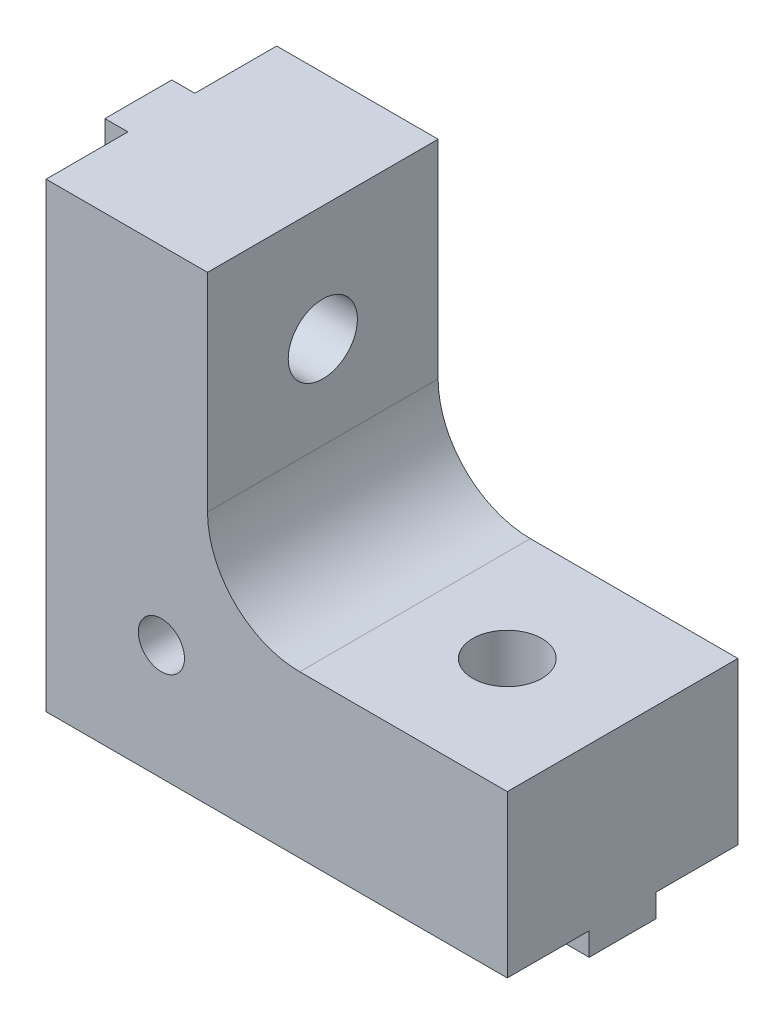
from build123d import *

# Parameters (mm, degrees)
MAIN_DEPTH                         = 10
ESQUISSE4_W                        = 2.9
ESQUISSE4_H                        = 20
MAKERBEAMFIXVERTICAL_DEPTH         = 1
MAKERBEAMVERTICALHOLE_DEPTH        = 31
MAKERBEAMVERTICALHOLE_DEPTH_BACK   = 31
ESQUISSE2_R                        = 1.5
ESQUISSE5_W                        = 20
ESQUISSE5_H                        = 2.9
MAKERBEAMFIXHORIZONTAL_DEPTH       = 1
MAKERBEAMHORIZONTALHOLE_DEPTH      = 31
MAKERBEAMHORIZONTALHOLE_DEPTH_BACK = 31
ESQUISSE3_R                        = 1.5
SKETCH1_R                          = 1
CUT_EXTRUDE1_DEPTH                 = 31


with BuildPart() as part:
    # Esquisse1 → Main (new body)
    with BuildSketch(Plane.XY):
        with BuildLine():
            Line((0, 0), (20, 0))
            Line((20, 0), (20, 7))
            Line((20, 7), (11, 7))
            ThreePointArc((11, 7), (8.171572875, 8.171572875), (7, 11))
            Line((7, 11), (7, 20))
            Line((7, 20), (0, 20))
            Line((0, 20), (0, 0))
        make_face()
    extrude(amount=MAIN_DEPTH)

    # Esquisse4 → MakerBeamFixVertical (add)
    with BuildSketch(Plane.ZY):
        with Locations((5, 10)):
            Rectangle(ESQUISSE4_W, ESQUISSE4_H)
    extrude(amount=MAKERBEAMFIXVERTICAL_DEPTH)

    # Esquisse2 → MakerBeamVerticalHole (cut, two sides: drawn at the far end of the back side and taken through both)
    with BuildSketch(Plane.ZY.offset(-MAKERBEAMVERTICALHOLE_DEPTH_BACK)):
        with Locations((5, 15)):
            Circle(ESQUISSE2_R)
    extrude(amount=MAKERBEAMVERTICALHOLE_DEPTH + MAKERBEAMVERTICALHOLE_DEPTH_BACK, mode=Mode.SUBTRACT)

    # Esquisse5 → MakerBeamFixHorizontal (add)
    with BuildSketch(Plane(origin=(0, 0, 0), x_dir=(-1, 0, 0), z_dir=(0, -1, 0))):
        with Locations((-10, -5)):
            Rectangle(ESQUISSE5_W, ESQUISSE5_H)
    extrude(amount=MAKERBEAMFIXHORIZONTAL_DEPTH)

    # Esquisse3 → MakerBeamHorizontalHole (cut, two sides: drawn at the far end of the back side and taken through both)
    with BuildSketch(Plane.XZ.offset(-MAKERBEAMHORIZONTALHOLE_DEPTH_BACK)):
        with Locations((15, 5)):
            Circle(ESQUISSE3_R)
    extrude(amount=MAKERBEAMHORIZONTALHOLE_DEPTH + MAKERBEAMHORIZONTALHOLE_DEPTH_BACK, mode=Mode.SUBTRACT)

    # Sketch1 → Cut-Extrude1 (cut, through all)
    with BuildSketch(Plane.XY.offset(10)):
        with Locations((5, 5)):
            Circle(SKETCH1_R)
    extrude(amount=-CUT_EXTRUDE1_DEPTH, mode=Mode.SUBTRACT)


solid = part.part
